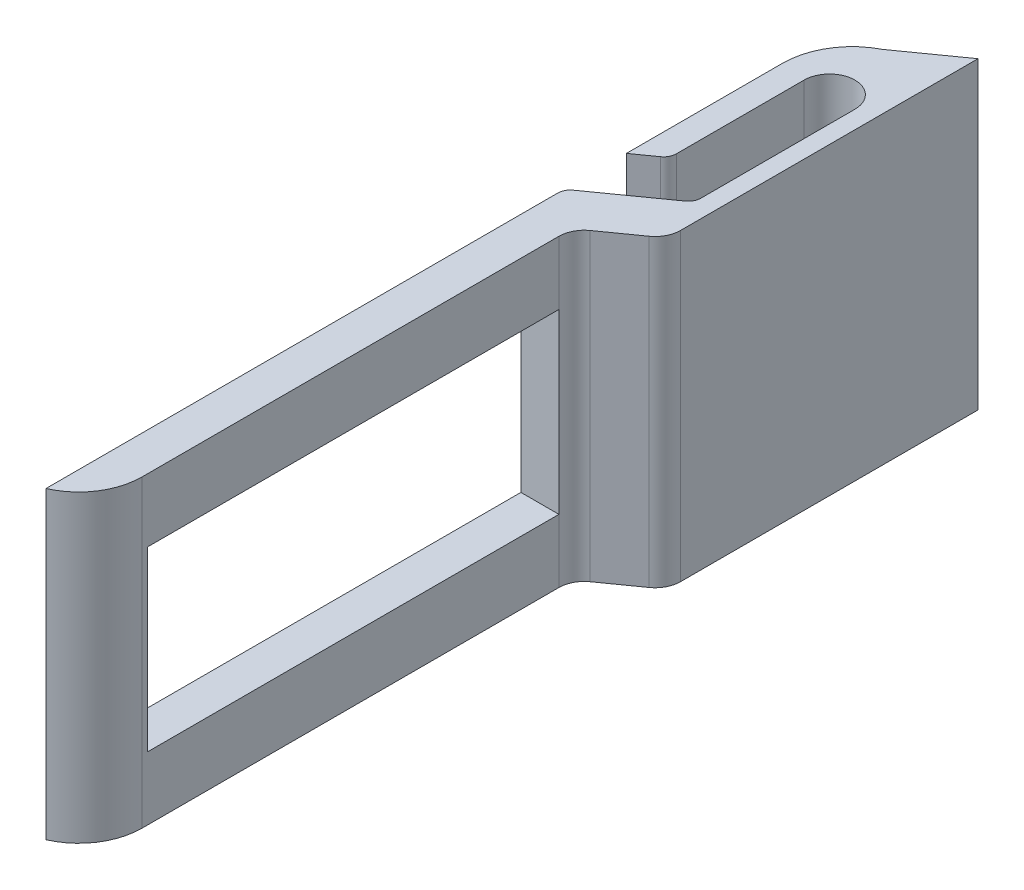
from build123d import *

# Parameters (mm, degrees)
BOSS_EXTRUDE1_DEPTH = 24
CUT_EXTRUDE1_DEPTH  = 24
FILLET5_R           = 1
FILLET6_R           = 5.5
FILLET8_R           = 2
SKETCH3_W           = 32.464758902
SKETCH3_H           = 14
CUT_EXTRUDE2_DEPTH  = 10
FILLET9_R           = 5


with BuildPart() as part:
    # Sketch1 → Boss-Extrude1 (new body)
    with BuildSketch(Plane(origin=(0, 0, 0), x_dir=(1, 0, 0), z_dir=(0, 1, 0))):
        Polygon((1.5, 36.5), (5.9, 39.627739059), (5.9, 15.124617794), (1.5, 11.996878735), (1.5, -26.5), (-1.5, -26.5), (-1.5, 36.5), align=None)
    extrude(amount=BOSS_EXTRUDE1_DEPTH)

    # Sketch2 → Cut-Extrude1 (cut)
    with BuildSketch(Plane(origin=(0, 24, 0), x_dir=(1, 0, 0), z_dir=(0, 1, 0))):
        with BuildLine():
            Line((-1.5, 14.383985508), (4.5, 18.649084224))
            Line((4.5, 18.649084224), (4.5, 31.313323891))
            ThreePointArc((4.5, 31.313323891), (2.5, 33.313323891), (0.5, 31.313323891))
            Line((0.5, 31.313323891), (0.5, 20.713323891))
            Line((0.5, 20.713323891), (-1.5, 19.291624318))
            Line((-1.5, 19.291624318), (-1.5, 14.383985508))
        make_face()
    extrude(amount=-CUT_EXTRUDE1_DEPTH, mode=Mode.SUBTRACT)

    # Fillet5
    fillet5_edges = [part.edges().sort_by_distance(p)[0] for p in [
        (-1.5, 12, -14.383985508),
        (0.5, 12, -20.713323891),
        (4.5, 12, -18.649084224),
    ]]
    fillet(fillet5_edges, radius=FILLET5_R)

    # Fillet6
    # the kernel refuses this fillet: 5.5 mm, written as the material it takes off along each edge
    with BuildSketch(Plane(origin=(-1.5, -12.247448714, -36.5), x_dir=(0, 0, 1), z_dir=(0, 1, 0))) as fillet6_piece_1:
        with BuildLine():
            CenterArc((4.898979486, 5.5), FILLET6_R, 207.035691789, 62.964308211)
            Line((0, 3), (-0.09797959, 2.95))
            ThreePointArc((-0.09797959, 2.95), (-0.11, 1.5), (-0.11, 0))
            Line((-0.11, 0), (0, -0.11))
            Line((0, -0.11), (4.898979486, -0.11))
            Line((4.898979486, -0.11), (4.898979486, 0))
        make_face()
    extrude(amount=48.494897428, mode=Mode.SUBTRACT)

    # Fillet8
    fillet8_edges = [part.edges().sort_by_distance(p)[0] for p in [
        (5.9, 12, -15.124617794),
        (1.5, 12, -11.996878735),
    ]]
    fillet(fillet8_edges, radius=FILLET8_R)

    # Sketch3 → Cut-Extrude2 (cut)
    with BuildSketch(Plane(origin=(1.5, 0, 0), x_dir=(0, 0, -1), z_dir=(1, 0, 0))):
        with Locations((-5.267620549, 12)):
            Rectangle(SKETCH3_W, SKETCH3_H)
    extrude(amount=-CUT_EXTRUDE2_DEPTH, mode=Mode.SUBTRACT)

    # Fillet9
    # the kernel refuses this fillet: 5 mm, written as the material it takes off along each edge
    with BuildSketch(Plane(origin=(1.5, -11.456439237, 26.5), x_dir=(0, 0, -1), z_dir=(0, 1, 0))) as fillet9_piece_1:
        with BuildLine():
            CenterArc((4.582575695, 5), FILLET9_R, 203.578178478, 66.421821522)
            Line((0, 3), (-0.091651514, 2.96))
            ThreePointArc((-0.091651514, 2.96), (-0.1, 1.5), (-0.1, 0))
            Line((-0.1, 0), (0, -0.1))
            Line((0, -0.1), (4.582575695, -0.1))
            Line((4.582575695, -0.1), (4.582575695, 0))
        make_face()
    extrude(amount=46.912878475, mode=Mode.SUBTRACT)


solid = part.part
